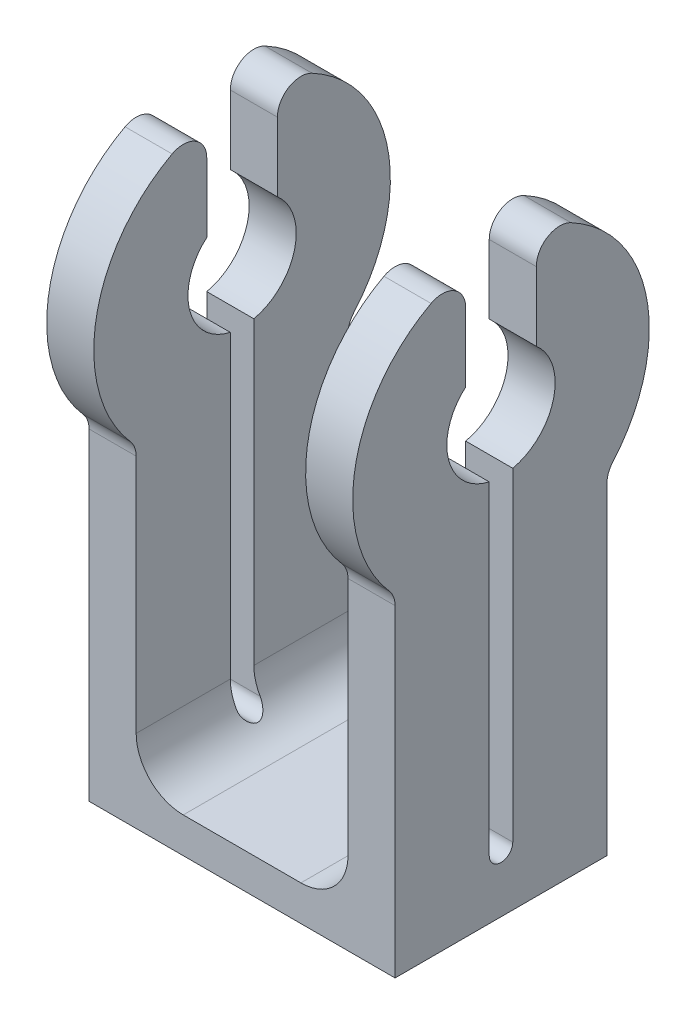
from build123d import *

# Parameters (mm, degrees)
SKETCH1_W            = 13
SKETCH1_H            = 9
BOSS_EXTRUDE1_DEPTH  = 1.5
BOSS_EXTRUDE2_DEPTH  = 2
FILLET1_R            = 1
FILLET1_OF_MIRROR1_R = 1
FILLET2_START        = -4.5
FILLET2_DEPTH        = 4
FILLET2_START_2      = 0.5
FILLET2_2_DEPTH      = 4
FILLET2_3_DEPTH      = 1.695635927
FILLET2_START_3      = 2.821367992
FILLET2_4_DEPTH      = 1.678632008
FILLET2_START_4      = -0.5
FILLET2_5_DEPTH      = 1
FILLET2_6_DEPTH      = 1


with BuildPart() as part:
    # Sketch1 → Boss-Extrude1 (new body)
    with BuildSketch(Plane(origin=(0, 0, 0), x_dir=(1, 0, 0), z_dir=(0, 1, 0))):
        Rectangle(SKETCH1_W, SKETCH1_H)
    extrude(amount=BOSS_EXTRUDE1_DEPTH)

    # Sketch2 → Boss-Extrude2 (add)
    with BuildSketch(Plane.ZY.offset(6.5)):
        with BuildLine():
            Line((-4.5, 1.5), (4.5, 1.5))
            Line((4.5, 1.5), (4.5, 14.090918463))
            ThreePointArc((4.5, 14.090918463), (6.058811408, 20.2265006), (1.5, 24.618823416))
            Line((1.5, 24.618823416), (1.5, 20.243559577))
            ThreePointArc((1.5, 20.243559577), (2.230950643, 17.940661794), (0.5, 16.255005568))
            Line((0.5, 16.255005568), (0.5, 2.5))
            ThreePointArc((0.5, 2.5), (0, 2), (-0.5, 2.5))
            Line((-0.5, 2.5), (-0.5, 16.255005568))
            ThreePointArc((-0.5, 16.255005568), (-2.230950643, 17.940661794), (-1.5, 20.243559577))
            Line((-1.5, 20.243559577), (-1.5, 24.618823416))
            ThreePointArc((-1.5, 24.618823416), (-6.058811408, 20.2265006), (-4.5, 14.090918463))
            Line((-4.5, 14.090918463), (-4.5, 1.5))
        make_face()
    boss_extrude2 = extrude(amount=-BOSS_EXTRUDE2_DEPTH)

    # Fillet1
    fillet1_edges = [part.edges().sort_by_distance(p)[0] for p in [
        (-5.5, 14.090918463, -4.5),
        (-5.5, 24.618823416, -1.5),
        (-5.5, 24.618823416, 1.5),
        (-5.5, 14.090918463, 4.5),
    ]]
    fillet(fillet1_edges, radius=FILLET1_R)

    # Mirror1: Boss-Extrude2 across plane
    add(boss_extrude2.mirror(Plane(origin=(0, 0, 0), x_dir=(0, 0, 1), z_dir=(1, 0, 0))))

    # Fillet1 of Mirror1
    fillet1_of_mirror1_edges = [part.edges().sort_by_distance(p)[0] for p in [
        (5.5, 14.090918463, -4.5),
        (5.5, 24.618823416, -1.5),
        (5.5, 24.618823416, 1.5),
        (5.5, 14.090918463, 4.5),
    ]]
    fillet(fillet1_of_mirror1_edges, radius=FILLET1_OF_MIRROR1_R)

    # Fillet2: read off the stored shape, not the designer's step
    # Fillet2 outline → Fillet2 (add)
    with BuildSketch(Plane.XY.offset(FILLET2_START)):
        with BuildLine():
            ThreePointArc((4.5, 3.5), (3.914213562, 2.085786438), (2.5, 1.5))
            Line((2.5, 1.5), (4.5, 1.5))
            Line((4.5, 1.5), (4.5, 3.5))
        make_face()
        with BuildLine():
            ThreePointArc((-2.5, 1.5), (-3.914213562, 2.085786438), (-4.5, 3.5))
            Line((-4.5, 3.5), (-4.5, 1.5))
            Line((-4.5, 1.5), (-2.5, 1.5))
        make_face()
    extrude(amount=FILLET2_DEPTH)

    # Fillet2 2 outline → Fillet2 2 (add)
    with BuildSketch(Plane.XY.offset(FILLET2_START_2)):
        with BuildLine():
            ThreePointArc((4.5, 3.5), (3.914213562, 2.085786438), (2.5, 1.5))
            Line((2.5, 1.5), (4.5, 1.5))
            Line((4.5, 1.5), (4.5, 3.5))
        make_face()
        with BuildLine():
            ThreePointArc((-2.5, 1.5), (-3.914213562, 2.085786438), (-4.5, 3.5))
            Line((-4.5, 3.5), (-4.5, 1.5))
            Line((-4.5, 1.5), (-2.5, 1.5))
        make_face()
    extrude(amount=FILLET2_2_DEPTH)

    # Fillet2 3 outline → Fillet2 3 (add)
    with BuildSketch(Plane.YZ.offset(FILLET2_START)):
        with BuildLine():
            Line((1.5, -0.5), (2.5, -0.5))
            ThreePointArc((2.5, -0.5), (2, 0), (2.5, 0.5))
            Line((2.5, 0.5), (1.5, 0.5))
            Line((1.5, 0.5), (1.5, -0.5))
        make_face()
    extrude(amount=FILLET2_3_DEPTH)

    # Fillet2 4 outline → Fillet2 4 (add)
    with BuildSketch(Plane.YZ.offset(FILLET2_START_3)):
        with BuildLine():
            Line((1.5, -0.5), (2.5, -0.5))
            ThreePointArc((2.5, -0.5), (2, 0), (2.5, 0.5))
            Line((2.5, 0.5), (1.5, 0.5))
            Line((1.5, 0.5), (1.5, -0.5))
        make_face()
    extrude(amount=FILLET2_4_DEPTH)

    # Fillet2 5 outline → Fillet2 5 (cut)
    with BuildSketch(Plane.XY.offset(FILLET2_START_4)):
        with BuildLine():
            Line((-4.5, 4), (-4.5, 3.5))
            ThreePointArc((-4.5, 3.5), (-4.018013199, 2.19783414), (-2.804364073, 1.523295037))
            Line((-2.804364073, 1.523295037), (-2.804364073, 4))
            Line((-2.804364073, 4), (-4.5, 4))
        make_face()
        with BuildLine():
            Line((4.5, 4), (2.821367992, 4))
            Line((2.821367992, 4), (2.821367992, 1.525988193))
            ThreePointArc((2.821367992, 1.525988193), (4.02360362, 2.204379683), (4.5, 3.5))
            Line((4.5, 3.5), (4.5, 4))
        make_face()
    extrude(amount=FILLET2_5_DEPTH, mode=Mode.SUBTRACT)

    # Fillet2 6 outline → Fillet2 6 (add)
    with BuildSketch(Plane.XY.offset(FILLET2_START_4)):
        with BuildLine():
            ThreePointArc((-2.5, 1.5), (-2.652627117, 1.505832263), (-2.804364073, 1.523295037))
            Line((-2.804364073, 1.523295037), (-2.804364073, 1.5))
            Line((-2.804364073, 1.5), (-2.5, 1.5))
        make_face()
        with BuildLine():
            ThreePointArc((2.821367992, 1.525988193), (2.661208539, 1.506507636), (2.5, 1.5))
            Line((2.5, 1.5), (2.821367992, 1.499999997))
            Line((2.821367992, 1.499999997), (2.821367992, 1.525988193))
        make_face()
    extrude(amount=FILLET2_6_DEPTH)


solid = part.part
